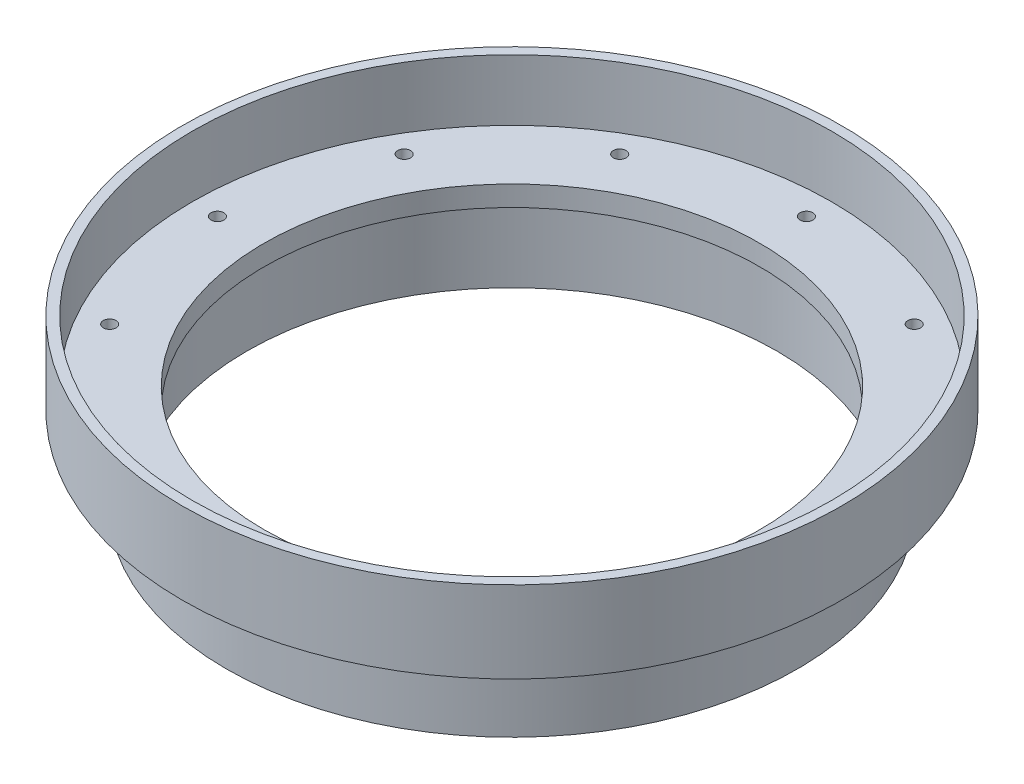
from build123d import *

# Parameters (mm, degrees)
SCREW_HOLES_COUNT = 12


with BuildPart() as part:
    # Cross Section → Main (revolve)
    with BuildSketch(Plane.XY):
        Polygon((-38.608, 0), (-38.608, -3.175), (-41.275, -3.175), (-41.275, -15.875), (-44.45, -15.875), (-44.45, -3.175), (-51.308, -3.175), (-51.308, 9.525), (-49.784, 9.525), (-49.784, 0), align=None)
    revolve(axis=Axis((0, 55, 0), (0, -1, 0)))

    # Sketch7 → #3-48 Tapped Hole1 (revolve, cut)
    with BuildSketch(Plane(origin=(-45.847, 0, 0), x_dir=(0, 0, 1), z_dir=(1, 0, 0))):
        Polygon((0, 0), (0, 3.901027994), (0.99695, 3.302), (0.99695, 0), align=None)
    f_3_48_tapped_hole1 = revolve(axis=Axis((-45.847, 6.35, 0), (0, -1, 0)), mode=Mode.SUBTRACT)

    # Screw Holes: #3-48 Tapped Hole1 ×12 about axis
    screw_holes_axis = Axis((0, 55, 0), (0, -1, 0))
    for i in range(1, SCREW_HOLES_COUNT):
        add(f_3_48_tapped_hole1.rotate(screw_holes_axis, i * 360 / SCREW_HOLES_COUNT), mode=Mode.SUBTRACT)


solid = part.part
